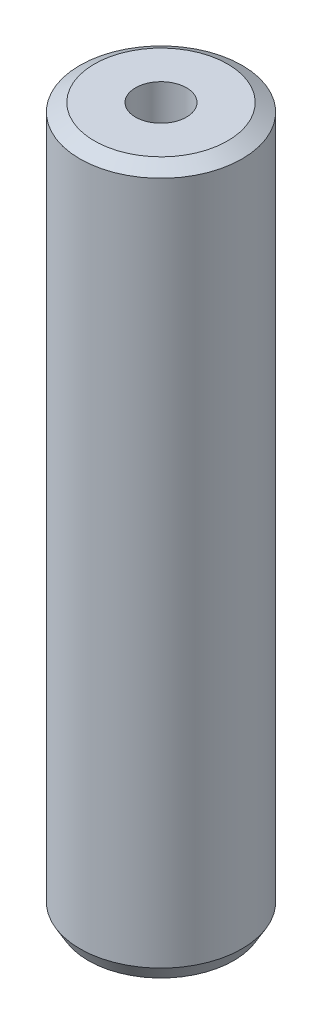
from build123d import *
from OCP.BRepFilletAPI import BRepFilletAPI_MakeChamfer

# Parameters (mm, degrees)
SKETCH1_R           = 27.5
BOSS_EXTRUDE1_DEPTH = 239.679760984
SKETCH2_R           = 8.638632334
CUT_EXTRUDE1_DEPTH  = 243.81451321
CHAMFER1_SIZE       = 2.832377456
CHAMFER1_SIZE2      = 4.905821661


with BuildPart() as part:
    # Sketch1 → Boss-Extrude1 (new body)
    with BuildSketch(Plane(origin=(0, 0, 0), x_dir=(1, 0, 0), z_dir=(0, 1, 0))):
        Circle(SKETCH1_R)
    extrude(amount=BOSS_EXTRUDE1_DEPTH)

    # Sketch2 → Cut-Extrude1 (cut, through all)
    with BuildSketch(Plane(origin=(0, 0, 0), x_dir=(1, 0, 0), z_dir=(0, 1, 0))):
        Circle(SKETCH2_R)
    extrude(amount=CUT_EXTRUDE1_DEPTH, mode=Mode.SUBTRACT)

    # Chamfer1: one chamfer whose edges measure the first distance from different faces: ONE call of the kernel's chamfer builder (chamfer() names one face for all edges)
    chamfer1_edges_1 = [part.edges().sort_by_distance(p)[0] for p in [
        (-27.5, 239.679760984, 0),
    ]]
    chamfer1_side_1 = [part.faces().sort_by_distance(p)[0] for p in [
        (-27.5, 119.839880492, 0),
    ]]
    chamfer1_edges_2 = [part.edges().sort_by_distance(p)[0] for p in [
        (-27.5, 0, 0),
    ]]
    chamfer1_side_2 = [part.faces().sort_by_distance(p)[0] for p in [
        (-26.722182541, 0, 0),
    ]]
    chamfer1 = BRepFilletAPI_MakeChamfer(part.part.solid().wrapped)
    for e in chamfer1_edges_1:
        chamfer1.Add(CHAMFER1_SIZE, CHAMFER1_SIZE2, e.wrapped, chamfer1_side_1[0].wrapped)  # the first distance lies on this face
    for e in chamfer1_edges_2:
        chamfer1.Add(CHAMFER1_SIZE, CHAMFER1_SIZE2, e.wrapped, chamfer1_side_2[0].wrapped)  # the first distance lies on this face
    add(Compound.cast(chamfer1.Shape()), mode=Mode.REPLACE)


solid = part.part
